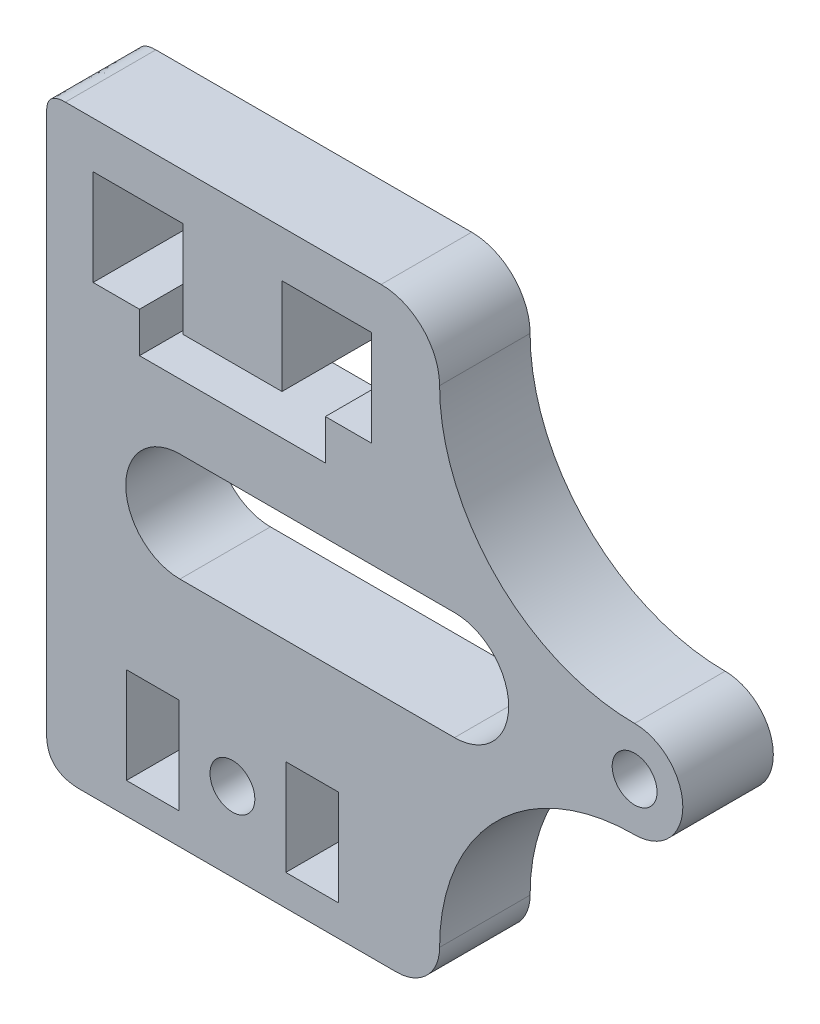
from build123d import *

# Parameters (mm, degrees)
SKETCH1_R           = 1.45
SKETCH1_W           = 3.400011
SKETCH1_H           = 6.2
BOSS_EXTRUDE2_DEPTH = 5.85


with BuildPart() as part:
    # Sketch1 → Boss-Extrude2 (new body)
    with BuildSketch(Plane.XY):
        with BuildLine():
            Line((388.759998918, 564.138903138), (409.174633119, 564.138903138))
            ThreePointArc((409.174633119, 564.138903138), (411.845213328, 563.032712595), (412.95140387, 560.362132386))
            ThreePointArc((412.95140387, 560.362132386), (416.644097047, 551.447182437), (425.559046996, 547.75448926))
            ThreePointArc((425.559046996, 547.75448926), (428.674633119, 544.638903138), (425.559046996, 541.523317015))
            ThreePointArc((425.559046996, 541.523317015), (416.644097047, 537.830623838), (412.95140387, 528.915673889))
            ThreePointArc((412.95140387, 528.915673889), (412.138106547, 526.952200461), (410.174633119, 526.138903138))
            Line((410.174633119, 526.138903138), (389.759998918, 526.138903138))
            add(Edge.make_bspline(
                [(387.555122745, 528.341524517), (387.433771666, 526.138903138), (389.759998918, 526.138903138)],
                knots=[0, 0, 0, 1, 1, 1], degree=2))
            Line((387.555122745, 528.341524517), (387.555122745, 562.935258521))
            add(Edge.make_bspline(
                [(387.555122745, 562.935258521), (387.488808592, 564.138903138), (388.759998918, 564.138903138)],
                knots=[0, 0, 0, 1, 1, 1], degree=2))
        make_face()
        with Locations((425.559046996, 544.638903138)):
            Circle(SKETCH1_R, mode=Mode.SUBTRACT)
        with Locations((399.559046996, 531.238903138)):
            Circle(SKETCH1_R, mode=Mode.SUBTRACT)
        Polygon((405.566920996, 552.338903138), (405.566920996, 554.938903138), (408.562971247, 554.938903138), (408.562971247, 561.138903138), (402.762971247, 561.138903138), (402.762971247, 554.938903138), (396.355122745, 554.938903138), (396.355122745, 561.138903138), (390.555122745, 561.138903138), (390.555122745, 554.938903138), (393.551172996, 554.938903138), (393.551172996, 552.338903138), align=None, mode=Mode.SUBTRACT)
        with Locations((394.409041496, 531.238903138)):
            Rectangle(SKETCH1_W, SKETCH1_H, mode=Mode.SUBTRACT)
        with Locations((404.709052496, 531.238903138)):
            Rectangle(SKETCH1_W, SKETCH1_H, mode=Mode.SUBTRACT)
        with BuildLine():
            Line((396.165690223, 548.138903138), (413.915690223, 548.138903138))
            ThreePointArc((413.915690223, 548.138903138), (417.415690223, 544.638903138), (413.915690223, 541.138903138))
            Line((413.915690223, 541.138903138), (396.165690223, 541.138903138))
            ThreePointArc((396.165690223, 541.138903138), (392.665690223, 544.638903138), (396.165690223, 548.138903138))
        make_face(mode=Mode.SUBTRACT)
    extrude(amount=BOSS_EXTRUDE2_DEPTH)


solid = part.part
